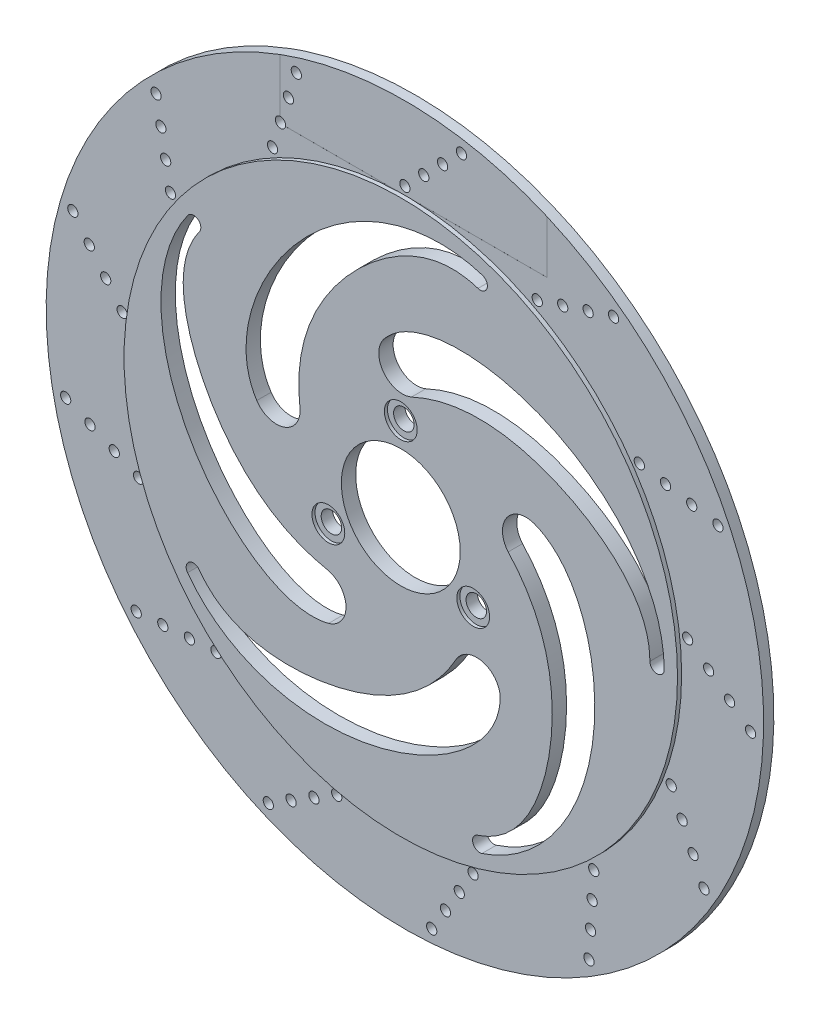
from build123d import *

# Parameters (mm, degrees)
SKETCH1_R           = 175
SKETCH1_R_2         = 29
BOSS_EXTRUDE1_DEPTH = 7
CUT_EXTRUDE1_START  = -2
SKETCH2_R           = 175
SKETCH2_R_2         = 135
CUT_EXTRUDE1_DEPTH  = 2
SKETCH3_R           = 5
CUT_EXTRUDE2_DEPTH  = 248.586348574
CIRPATTERN1_COUNT   = 3
SKETCH4_R           = 8
CUT_EXTRUDE3_DEPTH  = 1.5
CIRPATTERN2_COUNT   = 3
CUT_EXTRUDE5_START  = -7
CUT_EXTRUDE5_DEPTH  = 7
CIRPATTERN3_COUNT   = 5
SKETCH6_R           = 2.5
CUT_EXTRUDE6_DEPTH  = 248.586348718
CIRPATTERN4_COUNT   = 13
SKETCH8_R           = 175
SKETCH8_R_2         = 135
CUT_EXTRUDE7_DEPTH  = 0.01
SKETCH9_W           = 90.900327039
SKETCH9_H           = 40.914041524
CUT_EXTRUDE8_DEPTH  = 0.001
SKETCH10_W          = 130.294838349
SKETCH10_H          = 54.011108205
CUT_EXTRUDE9_DEPTH  = 0.01
SKETCH11_W          = 108.207821592
SKETCH11_H          = 46.030085343
CUT_EXTRUDE10_DEPTH = 0.01


# Read off the part's stored shape, not the designer's step: Cut-Extrude5
with BuildPart() as part:
    # Sketch1 → Boss-Extrude1 (new body)
    with BuildSketch(Plane.XY):
        Circle(SKETCH1_R)
        Circle(SKETCH1_R_2, mode=Mode.SUBTRACT)
    extrude(amount=BOSS_EXTRUDE1_DEPTH)

    # Sketch2 → Cut-Extrude1 (cut)
    with BuildSketch(Plane.XY.offset(7).offset(CUT_EXTRUDE1_START)):
        Circle(SKETCH2_R)
        Circle(SKETCH2_R_2, mode=Mode.SUBTRACT)
    extrude(amount=CUT_EXTRUDE1_DEPTH, mode=Mode.SUBTRACT)

    # Sketch3 → Cut-Extrude2 (cut, through all)
    with BuildSketch(Plane.XY.offset(7)):
        with Locations((0, 40.8)):
            Circle(SKETCH3_R)
    cut_extrude2 = extrude(amount=-CUT_EXTRUDE2_DEPTH, mode=Mode.SUBTRACT)

    # CirPattern1: Cut-Extrude2 ×3 about axis
    cirpattern1_axis = Axis((0, 0, 0), (0, 0, 1))
    for i in range(1, CIRPATTERN1_COUNT):
        add(cut_extrude2.rotate(cirpattern1_axis, i * 360 / CIRPATTERN1_COUNT), mode=Mode.SUBTRACT)

    # Sketch4 → Cut-Extrude3 (cut)
    with BuildSketch(Plane.XY.offset(7)):
        with Locations((0, 40.8)):
            Circle(SKETCH4_R)
    cut_extrude3 = extrude(amount=-CUT_EXTRUDE3_DEPTH, mode=Mode.SUBTRACT)

    # CirPattern2: Cut-Extrude3 ×3 about axis
    cirpattern2_axis = Axis((0, 0, 0), (0, 0, 1))
    for i in range(1, CIRPATTERN2_COUNT):
        add(cut_extrude3.rotate(cirpattern2_axis, i * 360 / CIRPATTERN2_COUNT), mode=Mode.SUBTRACT)

    # Cut-Extrude5 outline → Cut-Extrude5 (cut)
    with BuildSketch(Plane.XY.offset(7).offset(CUT_EXTRUDE5_START)):
        with BuildLine():
            ThreePointArc((121.499939496, -0.12298749), (124.999939496, -3.62298749), (128.499939496, -0.12298749))
            add(Edge.make_bspline(
                [(128.499939496, -0.12298749), (128.499939496, 31.638419222), (107.348855254, 74.121828628), (52.396465064, 93.291267066), (8.993017656, 92.632641356), (-8.214226951, 71.193884394)],
                knots=[0, 0, 0, 0, 0, 0, 1, 1, 1, 1, 1, 1], degree=5))
            ThreePointArc((-8.214226951, 71.193884394), (-8.426452431, 57.069934817), (5.212663873, 53.394952133))
            add(Edge.make_bspline(
                [(5.212663873, 53.394952133), (27.795809489, 63.896743321), (53.784046438, 66.244067949), (78.598621074, 55.010442945), (99.053878543, 43.441485852), (121.499939496, 28.129262896), (121.499939496, -0.12298749)],
                knots=[0, 0, 0, 0, 0, 0, 0, 1, 1, 1, 1, 1, 1, 1], degree=6))
        make_face()
    cut_extrude5 = extrude(amount=CUT_EXTRUDE5_DEPTH, mode=Mode.SUBTRACT)

    # CirPattern3: Cut-Extrude5 ×5 about axis
    cirpattern3_axis = Axis((0, 0, 7), (0, 0, 1))
    for i in range(1, CIRPATTERN3_COUNT):
        add(cut_extrude5.rotate(cirpattern3_axis, i * 360 / CIRPATTERN3_COUNT), mode=Mode.SUBTRACT)

    # Sketch6 → Cut-Extrude6 (cut, through all)
    with BuildSketch(Plane.XY.offset(7)):
        with Locations((0, 138.943546743)):
            Circle(SKETCH6_R)
        with Locations((9.192388155, 148.135934899)):
            Circle(SKETCH6_R)
        with Locations((18.384776311, 157.328323054)):
            Circle(SKETCH6_R)
        with Locations((27.577164466, 166.520711209)):
            Circle(SKETCH6_R)
    cut_extrude6 = extrude(amount=-CUT_EXTRUDE6_DEPTH, mode=Mode.SUBTRACT)

    # CirPattern4: Cut-Extrude6 ×13 about axis
    cirpattern4_axis = Axis((0, 0, 0), (0, 0, 1))
    for i in range(1, CIRPATTERN4_COUNT):
        add(cut_extrude6.rotate(cirpattern4_axis, i * 360 / CIRPATTERN4_COUNT), mode=Mode.SUBTRACT)

    # Sketch8 → Cut-Extrude7 (cut)
    with BuildSketch(Plane.XY):
        Circle(SKETCH8_R)
        Circle(SKETCH8_R_2, mode=Mode.SUBTRACT)
    extrude(amount=CUT_EXTRUDE7_DEPTH, mode=Mode.SUBTRACT)

    # Sketch9 → Cut-Extrude8 (cut)
    with BuildSketch(Plane.XY):
        with Locations((4.527748237, 155.446859957)):
            Rectangle(SKETCH9_W, SKETCH9_H)
    extrude(amount=CUT_EXTRUDE8_DEPTH, mode=Mode.SUBTRACT)

    # Sketch10 → Cut-Extrude9 (cut)
    with BuildSketch(Plane.XY.offset(5)):
        with Locations((4.215957898, 161.982952097)):
            Rectangle(SKETCH10_W, SKETCH10_H)
    extrude(amount=-CUT_EXTRUDE9_DEPTH, mode=Mode.SUBTRACT)

    # Sketch11 → Cut-Extrude10 (cut)
    with BuildSketch(Plane(origin=(0, 0, 0.01), x_dir=(-1, 0, 0), z_dir=(0, 0, -1))):
        with Locations((-1.268876231, 158.398747535)):
            Rectangle(SKETCH11_W, SKETCH11_H)
    extrude(amount=-CUT_EXTRUDE10_DEPTH, mode=Mode.SUBTRACT)


solid = part.part
